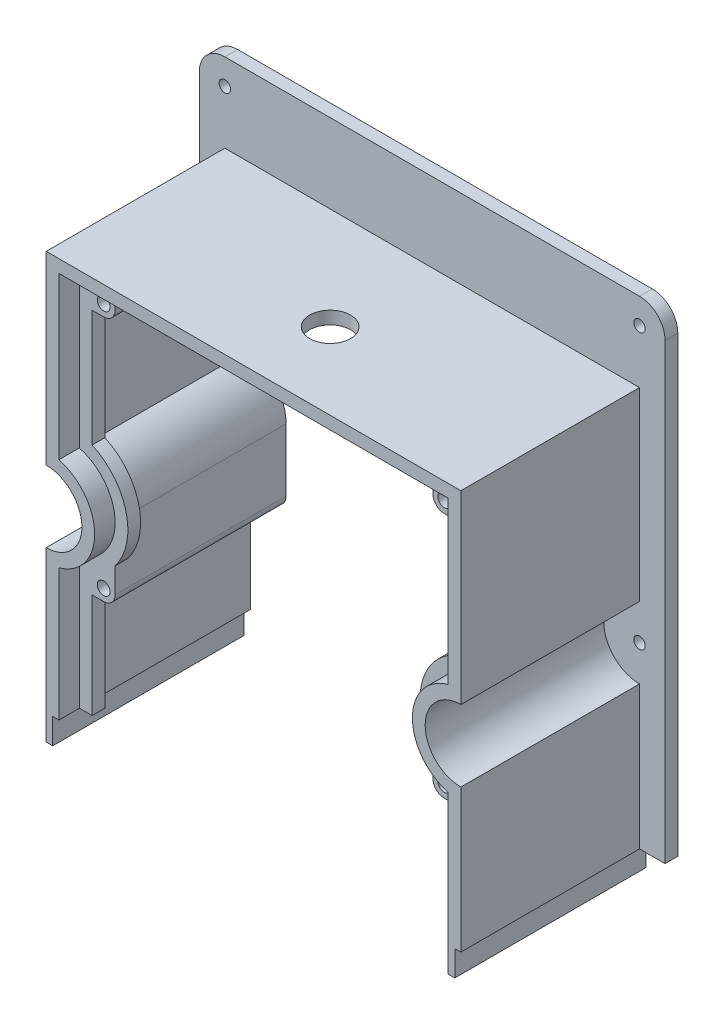
from build123d import *

# Parameters (mm, degrees)
SKETCH1_R               = 2.25
SKETCH1_R_2             = 7.9375
BOSS_EXTRUDE1_DEPTH     = 5
BOSS_EXTRUDE2_DEPTH     = 70
SKETCH3_R               = 8
CUT_EXTRUDE1_DEPTH      = 391.651691136
CUT_EXTRUDE2_DEPTH      = 1209.654326614
SKETCH5_R               = 7.9375
CUT_EXTRUDE3_DEPTH      = 1209.654326614
BOSS_EXTRUDE4_DEPTH     = 5
BOSS_EXTRUDE5_START     = -67
BOSS_EXTRUDE5_OUTLINE_R = 2.5
BOSS_EXTRUDE5_DEPTH     = 67
CUT_EXTRUDE4_DEPTH      = 1209.654326614
CUT_EXTRUDE4_DEPTH_BACK = 1209.654326614
CUT_EXTRUDE5_DEPTH      = 1009.510065127


# Read off the part's stored shape, not the designer's step: Boss-Extrude5
with BuildPart() as part:
    # Sketch1 → Boss-Extrude1 (new body)
    with BuildSketch(Plane.XY):
        with BuildLine():
            Line((-66.080112923, -1201.56262), (96.419887077, -1201.56262))
            ThreePointArc((96.419887077, -1201.56262), (106.319382013, -1197.462114937), (110.419887077, -1187.56262))
            Line((110.419887077, -1187.56262), (110.419887077, -812.43738))
            ThreePointArc((110.419887077, -812.43738), (106.319382013, -802.537885063), (96.419887077, -798.43738))
            Line((96.419887077, -798.43738), (-66.080112923, -798.43738))
            ThreePointArc((-66.080112923, -798.43738), (-75.97960786, -802.537885063), (-80.080112923, -812.43738))
            Line((-80.080112923, -812.43738), (-80.080112923, -1187.56262))
            ThreePointArc((-80.080112923, -1187.56262), (-75.97960786, -1197.462114937), (-66.080112923, -1201.56262))
        make_face()
        with Locations((96.419887077, -1080)):
            Circle(SKETCH1_R, mode=Mode.SUBTRACT)
        with Locations((88.147808187, -1029.0799835)):
            Circle(SKETCH1_R_2, mode=Mode.SUBTRACT)
        with Locations((-66.080112923, -1080)):
            Circle(SKETCH1_R, mode=Mode.SUBTRACT)
        with Locations((96.419887077, -920)):
            Circle(SKETCH1_R, mode=Mode.SUBTRACT)
        with Locations((-66.080112923, -920)):
            Circle(SKETCH1_R, mode=Mode.SUBTRACT)
        with Locations((-66.080112923, -1187.56262)):
            Circle(SKETCH1_R, mode=Mode.SUBTRACT)
        with Locations((96.419887077, -1187.56262)):
            Circle(SKETCH1_R, mode=Mode.SUBTRACT)
        with Locations((-66.080112923, -812.43738)):
            Circle(SKETCH1_R, mode=Mode.SUBTRACT)
        with Locations((96.419887077, -812.43738)):
            Circle(SKETCH1_R, mode=Mode.SUBTRACT)
    extrude(amount=-BOSS_EXTRUDE1_DEPTH)

    # Sketch2 → Boss-Extrude2 (add)
    with BuildSketch(Plane.XY):
        with BuildLine():
            Line((91.419887077, -1166.56262), (96.419887077, -1166.56262))
            Line((96.419887077, -1166.56262), (96.419887077, -1099))
            Line((96.419887077, -1099), (96.419887077, -1094))
            ThreePointArc((96.419887077, -1094), (82.419887077, -1080), (96.419887077, -1066))
            Line((96.419887077, -1066), (96.419887077, -1061))
            Line((96.419887077, -1061), (96.419887077, -1044.996221029))
            ThreePointArc((96.419887077, -1044.996221029), (106.085308187, -1029.0799835), (96.419887077, -1013.163745971))
            Line((96.419887077, -1013.163745971), (96.419887077, -939))
            Line((96.419887077, -939), (96.419887077, -934))
            ThreePointArc((96.419887077, -934), (82.419887077, -920), (96.419887077, -906))
            Line((96.419887077, -906), (96.419887077, -901))
            Line((96.419887077, -901), (96.419887077, -833.43738))
            Line((96.419887077, -833.43738), (91.419887077, -833.43738))
            Line((91.419887077, -833.43738), (-61.080112923, -833.43738))
            Line((-61.080112923, -833.43738), (-66.080112923, -833.43738))
            Line((-66.080112923, -833.43738), (-66.080112923, -901))
            Line((-66.080112923, -901), (-66.080112923, -906))
            ThreePointArc((-66.080112923, -906), (-56.180617987, -910.100505063), (-52.080112923, -920))
            ThreePointArc((-52.080112923, -920), (-56.180617987, -929.899494937), (-66.080112923, -934))
            Line((-66.080112923, -934), (-66.080112923, -939))
            Line((-66.080112923, -939), (-66.080112923, -1061))
            Line((-66.080112923, -1061), (-66.080112923, -1066))
            ThreePointArc((-66.080112923, -1066), (-56.180617987, -1070.100505063), (-52.080112923, -1080))
            ThreePointArc((-52.080112923, -1080), (-56.180617987, -1089.899494937), (-66.080112923, -1094))
            Line((-66.080112923, -1094), (-66.080112923, -1099))
            Line((-66.080112923, -1099), (-66.080112923, -1166.56262))
            Line((-66.080112923, -1166.56262), (-61.080112923, -1166.56262))
            Line((-61.080112923, -1166.56262), (91.419887077, -1166.56262))
        make_face()
        with BuildLine():
            Line((91.419887077, -1098.33030278), (91.419887077, -1161.56262))
            Line((91.419887077, -1161.56262), (-61.080112923, -1161.56262))
            Line((-61.080112923, -1161.56262), (-61.080112923, -1098.33030278))
            ThreePointArc((-61.080112923, -1098.33030278), (-47.080112923, -1080), (-61.080112923, -1061.66969722))
            Line((-61.080112923, -1061.66969722), (-61.080112923, -938.33030278))
            ThreePointArc((-61.080112923, -938.33030278), (-47.080112923, -920), (-61.080112923, -901.66969722))
            Line((-61.080112923, -901.66969722), (-61.080112923, -838.43738))
            Line((-61.080112923, -838.43738), (91.419887077, -838.43738))
            Line((91.419887077, -838.43738), (91.419887077, -901.66969722))
            ThreePointArc((91.419887077, -901.66969722), (77.419887077, -920), (91.419887077, -938.33030278))
            Line((91.419887077, -938.33030278), (91.419887077, -1011.443447389))
            Line((91.419887077, -1011.443447389), (91.419887077, -1016.563098664))
            ThreePointArc((91.419887077, -1016.563098664), (94.061132369, -1017.572963757), (96.419887077, -1019.132540759))
            ThreePointArc((96.419887077, -1019.132540759), (99.861025654, -1023.586401535), (101.085308187, -1029.0799835))
            ThreePointArc((101.085308187, -1029.0799835), (99.861025654, -1034.573565465), (96.419887077, -1039.027426241))
            ThreePointArc((96.419887077, -1039.027426241), (94.061132369, -1040.587003243), (91.419887077, -1041.596868336))
            Line((91.419887077, -1041.596868336), (91.419887077, -1046.716519611))
            Line((91.419887077, -1046.716519611), (91.419887077, -1061.66969722))
            ThreePointArc((91.419887077, -1061.66969722), (77.419887077, -1080), (91.419887077, -1098.33030278))
        make_face(mode=Mode.SUBTRACT)
    extrude(amount=BOSS_EXTRUDE2_DEPTH)

    # Sketch3 → Cut-Extrude1 (cut, through all)
    with BuildSketch(Plane(origin=(0, -833.43738, 0), x_dir=(1, 0, 0), z_dir=(0, 1, 0))):
        with Locations(Location((15.169887077, -40, 0), (0, 0, 270))):
            Circle(SKETCH3_R)
    extrude(amount=-CUT_EXTRUDE1_DEPTH, mode=Mode.SUBTRACT)

    # Sketch4 → Cut-Extrude2 (cut, through all)
    with BuildSketch(Plane.XY):
        with BuildLine():
            Line((-61.080112923, -1161.56262), (91.419887077, -1161.56262))
            Line((91.419887077, -1161.56262), (91.419887077, -1098.33030278))
            ThreePointArc((91.419887077, -1098.33030278), (77.419887077, -1080), (91.419887077, -1061.66969722))
            Line((91.419887077, -1061.66969722), (91.419887077, -1046.716519611))
            ThreePointArc((91.419887077, -1046.716519611), (70.210308187, -1029.0799835), (91.419887077, -1011.443447389))
            Line((91.419887077, -1011.443447389), (91.419887077, -938.33030278))
            ThreePointArc((91.419887077, -938.33030278), (77.419887077, -920), (91.419887077, -901.66969722))
            Line((91.419887077, -901.66969722), (91.419887077, -838.43738))
            Line((91.419887077, -838.43738), (-61.080112923, -838.43738))
            Line((-61.080112923, -838.43738), (-61.080112923, -901.66969722))
            ThreePointArc((-61.080112923, -901.66969722), (-47.080112923, -920), (-61.080112923, -938.33030278))
            Line((-61.080112923, -938.33030278), (-61.080112923, -1061.66969722))
            ThreePointArc((-61.080112923, -1061.66969722), (-47.080112923, -1080), (-61.080112923, -1098.33030278))
            Line((-61.080112923, -1098.33030278), (-61.080112923, -1161.56262))
        make_face()
    extrude(amount=-CUT_EXTRUDE2_DEPTH, mode=Mode.SUBTRACT)

    # Sketch5 → Cut-Extrude3 (cut, through all)
    # profile 1 of 2: a face of its own
    with BuildSketch(Plane.XY):
        with BuildLine():
            ThreePointArc((101.085308187, -1029.0799835), (98.387716069, -1021.172822644), (91.419887077, -1016.563098664))
            ThreePointArc((91.419887077, -1016.563098664), (75.210308187, -1029.0799835), (91.419887077, -1041.596868336))
            ThreePointArc((91.419887077, -1041.596868336), (98.387716069, -1036.987144356), (101.085308187, -1029.0799835))
        make_face()
        with Locations((88.147808187, -1029.0799835)):
            Circle(SKETCH5_R, mode=Mode.SUBTRACT)
    # profile 2 of 2: a face of its own
    with BuildSketch(Plane.XY):
        with BuildLine():
            Line((91.419887077, -1016.563098664), (91.419887077, -1011.443447389))
            ThreePointArc((91.419887077, -1011.443447389), (70.210308187, -1029.0799835), (91.419887077, -1046.716519611))
            Line((91.419887077, -1046.716519611), (91.419887077, -1041.596868336))
            ThreePointArc((91.419887077, -1041.596868336), (75.210308187, -1029.0799835), (91.419887077, -1016.563098664))
        make_face()
    extrude(amount=-CUT_EXTRUDE3_DEPTH, mode=Mode.SUBTRACT)

    # Sketch9 → Boss-Extrude4 (add)
    with BuildSketch(Plane.XY.offset(62)):
        with BuildLine():
            Line((-61.080112923, -1098.33030278), (-61.080112923, -1161.56262))
            Line((-61.080112923, -1161.56262), (91.419887077, -1161.56262))
            Line((91.419887077, -1161.56262), (91.419887077, -1098.33030278))
            ThreePointArc((91.419887077, -1098.33030278), (77.419887077, -1080), (91.419887077, -1061.66969722))
            Line((91.419887077, -1061.66969722), (91.419887077, -1041.596868336))
            ThreePointArc((91.419887077, -1041.596868336), (101.085308187, -1029.0799835), (91.419887077, -1016.563098664))
            Line((91.419887077, -1016.563098664), (91.419887077, -938.33030278))
            ThreePointArc((91.419887077, -938.33030278), (77.419887077, -920), (91.419887077, -901.66969722))
            Line((91.419887077, -901.66969722), (91.419887077, -838.43738))
            Line((91.419887077, -838.43738), (-61.080112923, -838.43738))
            Line((-61.080112923, -838.43738), (-61.080112923, -901.66969722))
            ThreePointArc((-61.080112923, -901.66969722), (-47.080112923, -920), (-61.080112923, -938.33030278))
            Line((-61.080112923, -938.33030278), (-61.080112923, -1061.66969722))
            ThreePointArc((-61.080112923, -1061.66969722), (-47.080112923, -1080), (-61.080112923, -1098.33030278))
        make_face()
        with BuildLine():
            Line((86.419887077, -843.43738), (-56.080112923, -843.43738))
            Line((-56.080112923, -843.43738), (-56.080112923, -898.182575771))
            ThreePointArc((-56.080112923, -898.182575771), (-42.080112923, -920), (-56.080112923, -941.817424229))
            Line((-56.080112923, -941.817424229), (-56.080112923, -1058.182575771))
            ThreePointArc((-56.080112923, -1058.182575771), (-42.080112923, -1080), (-56.080112923, -1101.817424229))
            Line((-56.080112923, -1101.817424229), (-56.080112923, -1156.56262))
            Line((-56.080112923, -1156.56262), (86.419887077, -1156.56262))
            Line((86.419887077, -1156.56262), (86.419887077, -1101.817424229))
            ThreePointArc((86.419887077, -1101.817424229), (72.419887077, -1080), (86.419887077, -1058.182575771))
            Line((86.419887077, -1058.182575771), (86.419887077, -1036.827124578))
            ThreePointArc((86.419887077, -1036.827124578), (96.085308187, -1029.0799835), (86.419887077, -1021.332842422))
            Line((86.419887077, -1021.332842422), (86.419887077, -941.817424229))
            ThreePointArc((86.419887077, -941.817424229), (72.419887077, -920), (86.419887077, -898.182575771))
            Line((86.419887077, -898.182575771), (86.419887077, -843.43738))
        make_face(mode=Mode.SUBTRACT)
    extrude(amount=-BOSS_EXTRUDE4_DEPTH)

    # Boss-Extrude5 outline → Boss-Extrude5 (add)
    # profile 1 of 8: a face of its own
    with BuildSketch(Plane(origin=(0, 0, -5), x_dir=(-1, 0, 0), z_dir=(0, 0, -1)).offset(BOSS_EXTRUDE5_START)):
        with BuildLine():
            ThreePointArc((-77.419887077, -1152.06262), (-78.737906562, -1148.880639485), (-81.919887077, -1147.56262))
            Line((-81.919887077, -1147.56262), (-91.419887077, -1147.56262))
            Line((-91.419887077, -1147.56262), (-91.419887077, -1161.56262))
            Line((-91.419887077, -1161.56262), (-77.419887077, -1161.56262))
            Line((-77.419887077, -1161.56262), (-77.419887077, -1152.06262))
        make_face()
        with Locations((-81.919887077, -1152.06262)):
            Circle(BOSS_EXTRUDE5_OUTLINE_R, mode=Mode.SUBTRACT)
    # profile 2 of 8: a face of its own
    with BuildSketch(Plane(origin=(0, 0, -5), x_dir=(-1, 0, 0), z_dir=(0, 0, -1)).offset(BOSS_EXTRUDE5_START)):
        with BuildLine():
            Line((-81.919887077, -1050.964311707), (-91.419887077, -1050.964311707))
            Line((-91.419887077, -1050.964311707), (-91.419887077, -1061.66969722))
            ThreePointArc((-91.419887077, -1061.66969722), (-81.320218206, -1068.467437405), (-77.419887077, -1080))
            Line((-77.419887077, -1080), (-77.419887077, -1055.464311707))
            ThreePointArc((-77.419887077, -1055.464311707), (-78.737906561, -1052.282331191), (-81.919887077, -1050.964311707))
        make_face()
        with Locations((-81.919887077, -1055.464311707)):
            Circle(BOSS_EXTRUDE5_OUTLINE_R, mode=Mode.SUBTRACT)
    # profile 3 of 8: a face of its own
    with BuildSketch(Plane(origin=(0, 0, -5), x_dir=(-1, 0, 0), z_dir=(0, 0, -1)).offset(BOSS_EXTRUDE5_START)):
        with BuildLine():
            Line((61.080112923, -1147.56262), (51.580112923, -1147.56262))
            ThreePointArc((51.580112923, -1147.56262), (48.398132408, -1148.880639485), (47.080112923, -1152.06262))
            Line((47.080112923, -1152.06262), (47.080112923, -1161.56262))
            Line((47.080112923, -1161.56262), (61.080112923, -1161.56262))
            Line((61.080112923, -1161.56262), (61.080112923, -1147.56262))
        make_face()
        with Locations((51.580112923, -1152.06262)):
            Circle(BOSS_EXTRUDE5_OUTLINE_R, mode=Mode.SUBTRACT)
    # profile 4 of 8: a face of its own
    with BuildSketch(Plane(origin=(0, 0, -5), x_dir=(-1, 0, 0), z_dir=(0, 0, -1)).offset(BOSS_EXTRUDE5_START)):
        with BuildLine():
            Line((61.080112923, -1050.964311707), (51.580112923, -1050.964311707))
            ThreePointArc((51.580112923, -1050.964311707), (48.398132408, -1052.282331192), (47.080112923, -1055.464311707))
            Line((47.080112923, -1055.464311707), (47.101209294, -1079.104892724))
            ThreePointArc((47.101209294, -1079.104892724), (51.256366252, -1068.114860765), (61.080112923, -1061.66969722))
            Line((61.080112923, -1061.66969722), (61.080112923, -1050.964311707))
        make_face()
        with Locations((51.580112923, -1055.464311707)):
            Circle(BOSS_EXTRUDE5_OUTLINE_R, mode=Mode.SUBTRACT)
    # profile 5 of 8: a face of its own
    with BuildSketch(Plane(origin=(0, 0, -5), x_dir=(-1, 0, 0), z_dir=(0, 0, -1)).offset(BOSS_EXTRUDE5_START)):
        with BuildLine():
            Line((47.080112923, -920), (47.080112923, -944.535688293))
            ThreePointArc((47.080112923, -944.535688293), (48.398132408, -947.717668808), (51.580112923, -949.035688293))
            Line((51.580112923, -949.035688293), (61.080112923, -949.035688293))
            Line((61.080112923, -949.035688293), (61.080112923, -938.33030278))
            ThreePointArc((61.080112923, -938.33030278), (50.980444052, -931.532562595), (47.080112923, -920))
        make_face()
        with Locations((51.580112923, -944.535688293)):
            Circle(BOSS_EXTRUDE5_OUTLINE_R, mode=Mode.SUBTRACT)
    # profile 6 of 8: a face of its own
    with BuildSketch(Plane(origin=(0, 0, -5), x_dir=(-1, 0, 0), z_dir=(0, 0, -1)).offset(BOSS_EXTRUDE5_START)):
        with BuildLine():
            Line((47.080112923, -838.43738), (47.080112923, -847.93738))
            ThreePointArc((47.080112923, -847.93738), (48.398132408, -851.119360515), (51.580112923, -852.43738))
            Line((51.580112923, -852.43738), (61.080112923, -852.43738))
            Line((61.080112923, -852.43738), (61.080112923, -838.43738))
            Line((61.080112923, -838.43738), (47.080112923, -838.43738))
        make_face()
        with Locations((51.580112923, -847.93738)):
            Circle(BOSS_EXTRUDE5_OUTLINE_R, mode=Mode.SUBTRACT)
    # profile 7 of 8: a face of its own
    with BuildSketch(Plane(origin=(0, 0, -5), x_dir=(-1, 0, 0), z_dir=(0, 0, -1)).offset(BOSS_EXTRUDE5_START)):
        with BuildLine():
            Line((-91.419887077, -852.43738), (-81.919887077, -852.43738))
            ThreePointArc((-81.919887077, -852.43738), (-78.737906561, -851.119360516), (-77.419887077, -847.93738))
            Line((-77.419887077, -847.93738), (-77.419887077, -838.43738))
            Line((-77.419887077, -838.43738), (-91.419887077, -838.43738))
            Line((-91.419887077, -838.43738), (-91.419887077, -852.43738))
        make_face()
        with Locations((-81.919887077, -847.93738)):
            Circle(BOSS_EXTRUDE5_OUTLINE_R, mode=Mode.SUBTRACT)
    # profile 8 of 8: a face of its own
    with BuildSketch(Plane(origin=(0, 0, -5), x_dir=(-1, 0, 0), z_dir=(0, 0, -1)).offset(BOSS_EXTRUDE5_START)):
        with BuildLine():
            Line((-91.419887077, -949.035688293), (-81.919887077, -949.035688293))
            ThreePointArc((-81.919887077, -949.035688293), (-78.737906562, -947.717668808), (-77.419887077, -944.535688293))
            Line((-77.419887077, -944.535688293), (-77.419887077, -920))
            ThreePointArc((-77.419887077, -920), (-81.320218206, -931.532562595), (-91.419887077, -938.33030278))
            Line((-91.419887077, -938.33030278), (-91.419887077, -949.035688293))
        make_face()
        with BuildLine():
            Line((-86.415652438, -944.340511931), (-86.414971961, -944.745954498))
            ThreePointArc((-86.414971961, -944.745954498), (-86.419880739, -944.543240882), (-86.415652438, -944.340511931))
        make_face(mode=Mode.SUBTRACT)
        with Locations((-81.919887077, -944.535688293)):
            Circle(BOSS_EXTRUDE5_OUTLINE_R, mode=Mode.SUBTRACT)
    extrude(amount=BOSS_EXTRUDE5_DEPTH)

    # Sketch13 → Cut-Extrude4 (cut, two sides: drawn at the far end of the back side and taken through both)
    with BuildSketch(Plane.XY.offset(-CUT_EXTRUDE4_DEPTH_BACK)):
        Polygon((94.023297062, -1000), (94.023297062, -990), (113.715152321, -990), (110.419887077, -1000), (180.991747424, -1022.37445391), (169.051741721, -1117.894499535), (178.766489059, -1320.824777271), (-54.387447063, -1291.680535255), (-189.224542066, -1144.69750743), (-91.869342688, -1000), (-66.080112923, -1000), (-63.520729079, -1000), (-63.520729079, -990), (82.322721203, -990), (82.322721203, -1000), align=None)
    extrude(amount=CUT_EXTRUDE4_DEPTH + CUT_EXTRUDE4_DEPTH_BACK, mode=Mode.SUBTRACT)

    # Sketch14 → Cut-Extrude5 (cut, through all)
    with BuildSketch(Plane.XY):
        with BuildLine():
            Line((-76.080112923, -1000), (-114.548207205, -1013.362990202))
            Line((-114.548207205, -1013.362990202), (-112.250375439, -756.771776282))
            Line((-112.250375439, -756.771776282), (134.000595533, -776.686318257))
            Line((134.000595533, -776.686318257), (134.000595533, -1013.362990202))
            Line((134.000595533, -1013.362990202), (106.419887077, -990))
            Line((106.419887077, -990), (106.419887077, -812.43738))
            ThreePointArc((106.419887077, -812.43738), (103.490954888, -805.366312188), (96.419887077, -802.43738))
            Line((96.419887077, -802.43738), (-66.080112923, -802.43738))
            ThreePointArc((-66.080112923, -802.43738), (-73.151180735, -805.366312188), (-76.080112923, -812.43738))
            Line((-76.080112923, -812.43738), (-76.080112923, -1000))
        make_face()
    extrude(amount=-CUT_EXTRUDE5_DEPTH, mode=Mode.SUBTRACT)


solid = part.part
